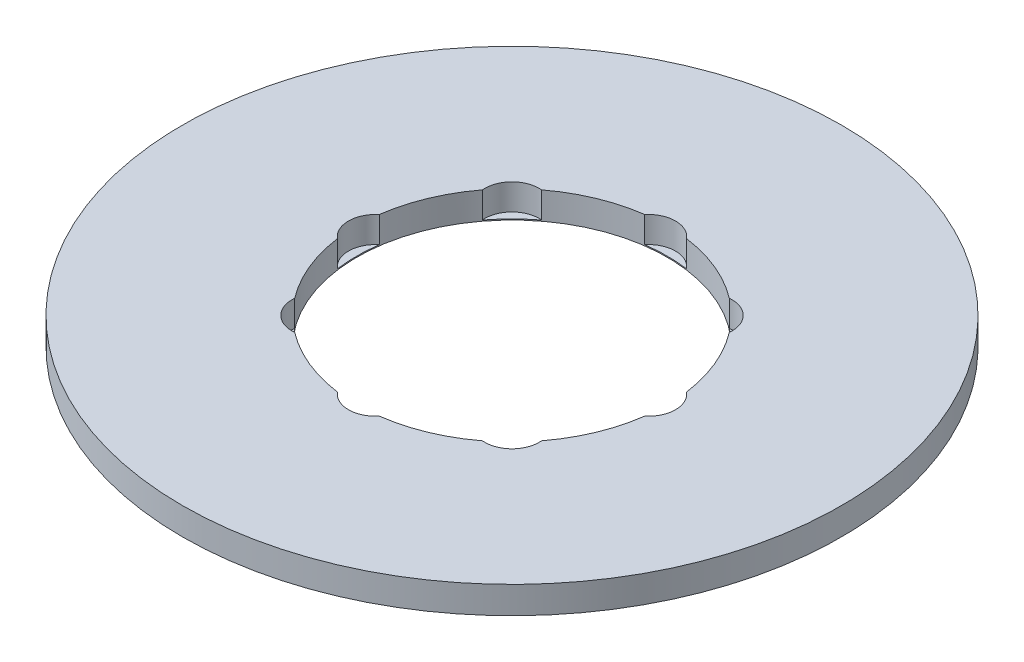
from build123d import *

# Parameters (mm, degrees)
SKETCH1_R           = 85
BOSS_EXTRUDE1_DEPTH = 7
SKETCH2_R           = 40
CUT_EXTRUDE1_DEPTH  = 121.411793442
SKETCH3_R           = 7.005843143
CUT_EXTRUDE2_DEPTH  = 6.72921496
CIRPATTERN1_COUNT   = 8


with BuildPart() as part:
    # Sketch1 → Boss-Extrude1 (new body)
    with BuildSketch(Plane(origin=(0, 0, 0), x_dir=(1, 0, 0), z_dir=(0, 1, 0))):
        Circle(SKETCH1_R)
    extrude(amount=BOSS_EXTRUDE1_DEPTH)

    # Sketch2 → Cut-Extrude1 (cut, through all)
    with BuildSketch(Plane(origin=(0, 0, 0), x_dir=(1, 0, 0), z_dir=(0, 1, 0))):
        Circle(SKETCH2_R)
    extrude(amount=CUT_EXTRUDE1_DEPTH, mode=Mode.SUBTRACT)

    # Sketch3 → Cut-Extrude2 (cut)
    with BuildSketch(Plane(origin=(0, 7, 0), x_dir=(1, 0, 0), z_dir=(0, 1, 0))):
        with Locations((-35.166113495, 0)):
            Circle(SKETCH3_R)
    cut_extrude2 = extrude(amount=-CUT_EXTRUDE2_DEPTH, mode=Mode.SUBTRACT)

    # CirPattern1: Cut-Extrude2 ×8 about axis
    cirpattern1_axis = Axis((0, 0, 0), (0, 1, 0))
    for i in range(1, CIRPATTERN1_COUNT):
        add(cut_extrude2.rotate(cirpattern1_axis, i * 360 / CIRPATTERN1_COUNT), mode=Mode.SUBTRACT)


solid = part.part
